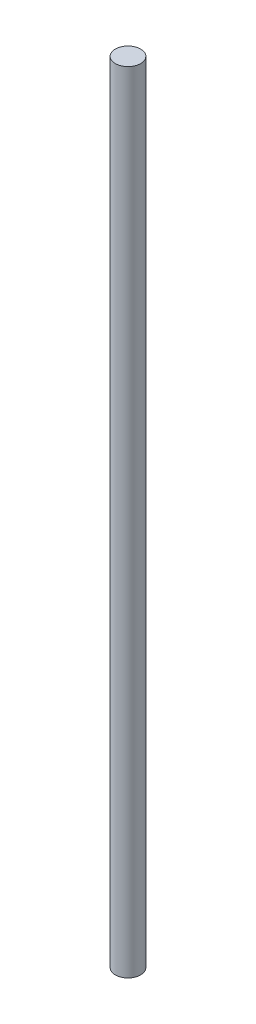
from build123d import *

# Parameters (mm, degrees)
SKETCH1_R           = 4
BOSS_EXTRUDE1_DEPTH = 250


with BuildPart() as part:
    # Sketch1 → Boss-Extrude1 (new body)
    with BuildSketch(Plane(origin=(0, 0, 0), x_dir=(1, 0, 0), z_dir=(0, 1, 0))):
        Circle(SKETCH1_R)
    extrude(amount=BOSS_EXTRUDE1_DEPTH)


solid = part.part
